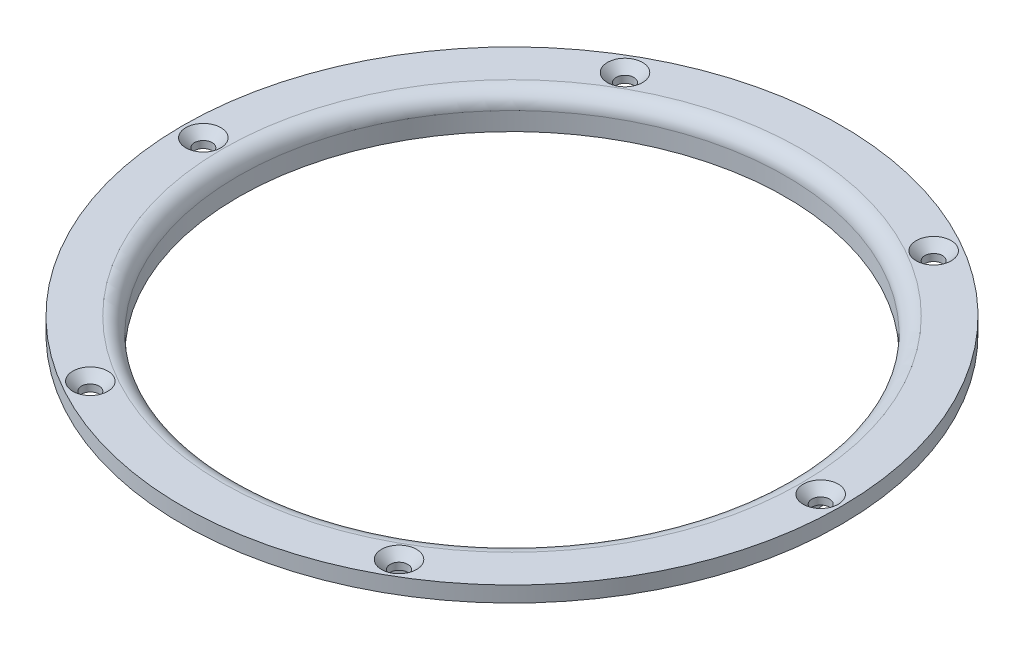
from build123d import *

# Parameters (mm, degrees)
CIRPATTERN1_COUNT = 6
FILLET1_R         = 3


with BuildPart() as part:
    # Sketch3 → Cap (revolve)
    with BuildSketch(Plane.XY):
        Polygon((-55, 8.3), (-52.5, 8.3), (-52.5, 14.8), (-63.2, 14.8), (-63.2, 11.8), (-55, 11.8), align=None)
    revolve(axis=Axis((0, 0, 0), (0, 1, 0)))

    # Sketch12 → CSK for M3 SFHCS1 (revolve, cut)
    with BuildSketch(Plane(origin=(-59.2, 14.8, 0), x_dir=(0, 0, 1), z_dir=(1, 0, 0))):
        Polygon((0, 0), (0, 9.911463052), (1.7, 8.89), (1.7, 1.66), (3.36, 0), align=None)
    csk_for_m3_sfhcs1 = revolve(axis=Axis((-59.2, 21.15, 0), (0, -1, 0)), mode=Mode.SUBTRACT)

    # CirPattern1: CSK for M3 SFHCS1 ×6 about axis
    cirpattern1_axis = Axis((0, 0, 0), (0, 1, 0))
    for i in range(1, CIRPATTERN1_COUNT):
        add(csk_for_m3_sfhcs1.rotate(cirpattern1_axis, i * 360 / CIRPATTERN1_COUNT), mode=Mode.SUBTRACT)

    # Fillet1
    fillet1_edges = [part.edges().sort_by_distance(p)[0] for p in [
        (52.5, 14.8, 0),
    ]]
    fillet(fillet1_edges, radius=FILLET1_R)


solid = part.part
